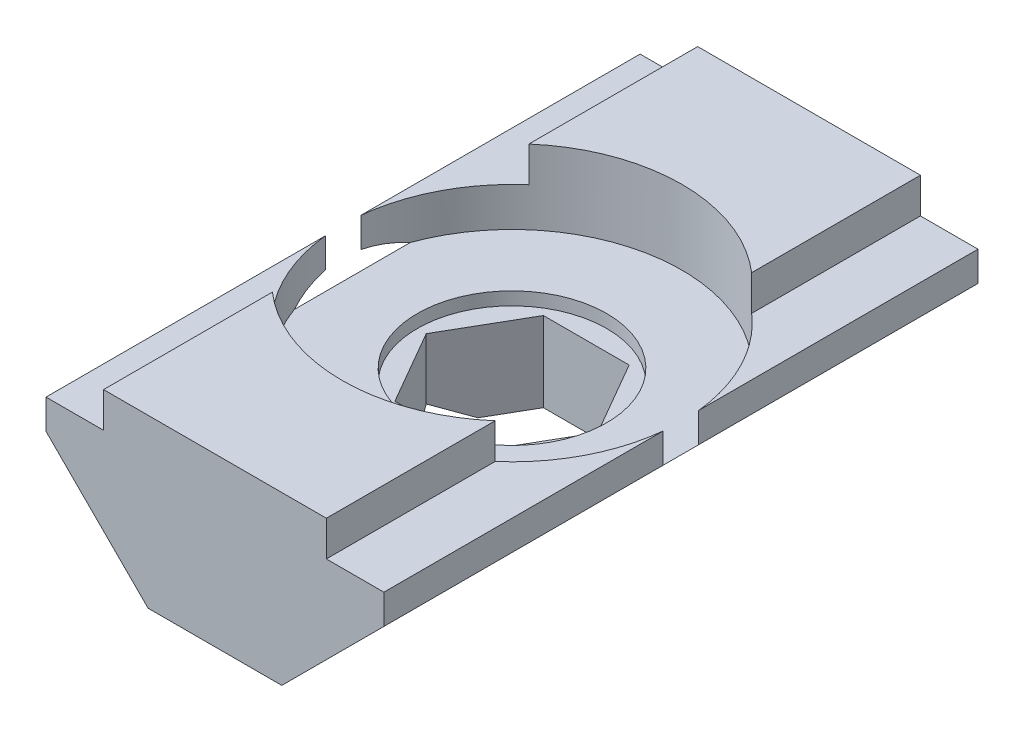
from build123d import *

# Parameters (mm, degrees)
BOSS_EXTRUDE1_DEPTH = 16
SKETCH2_R           = 4.575
CUT_EXTRUDE1_DEPTH  = 2
CUT_EXTRUDE2_DEPTH  = 18.867638344
SKETCH4_R           = 2.55
CUT_EXTRUDE3_DEPTH  = 0.35


with BuildPart() as part:
    # Sketch1 → Boss-Extrude1 (new body)
    with BuildSketch(Plane.XY):
        Polygon((0, 0), (0, 0.95), (6, 0.95), (6, 0), (7.55, 0), (7.55, -0.8), (4.8, -3.55), (1.2, -3.55), (-1.55, -0.8), (-1.55, 0), align=None)
    extrude(amount=BOSS_EXTRUDE1_DEPTH)

    # Sketch2 → Cut-Extrude1 (cut)
    with BuildSketch(Plane(origin=(0, 0.95, 0), x_dir=(1, 0, 0), z_dir=(0, 1, 0))):
        with Locations((3, -8)):
            Circle(SKETCH2_R)
    extrude(amount=-CUT_EXTRUDE1_DEPTH, mode=Mode.SUBTRACT)

    # Sketch3 → Cut-Extrude2 (cut, through all)
    with BuildSketch(Plane(origin=(0, -1.05, 0), x_dir=(1, 0, 0), z_dir=(0, 1, 0))):
        Polygon((5.309401077, -8), (4.154700538, -6), (1.845299462, -6), (0.690598923, -8), (1.845299462, -10), (4.154700538, -10), align=None)
    extrude(amount=-CUT_EXTRUDE2_DEPTH, mode=Mode.SUBTRACT)

    # Sketch4 → Cut-Extrude3 (cut)
    with BuildSketch(Plane(origin=(0, -1.05, 0), x_dir=(1, 0, 0), z_dir=(0, 1, 0))):
        with Locations((3, -8)):
            Circle(SKETCH4_R)
    extrude(amount=-CUT_EXTRUDE3_DEPTH, mode=Mode.SUBTRACT)


solid = part.part
